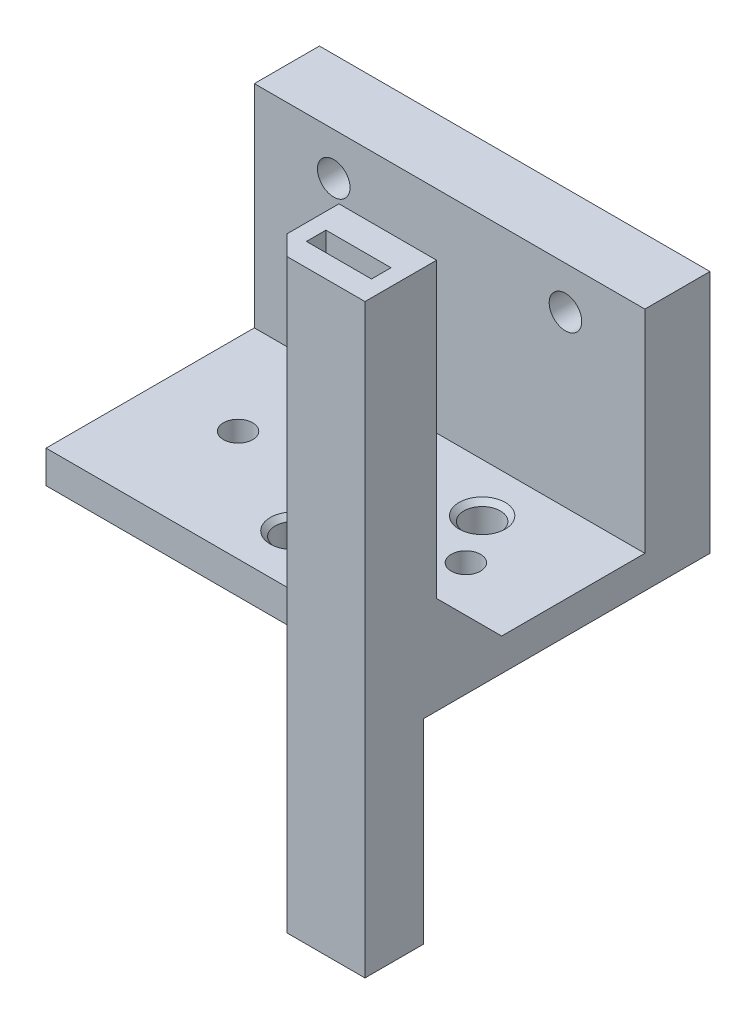
from build123d import *

# Parameters (mm, degrees)
SKETCH1_R                = 2.8
SKETCH1_R_2              = 2.25
BOSS_EXTRUDE1_DEPTH      = 5
SKETCH3_W                = 60
SKETCH3_H                = 10
BOSS_EXTRUDE3_DEPTH      = 32.5
SKETCH4_R                = 2.5
CUT_EXTRUDE1_DEPTH       = 64.798510954
CHAMFER1_SIZE            = 0.75
BOSS_EXTRUDE4_DEPTH      = 30
BOSS_EXTRUDE4_DEPTH_BACK = 60
SKETCH5_W                = 10
SKETCH5_H                = 3
CHAMFER2_SIZE            = 10
CHAMFER3_SIZE            = 5
SKETCH7_W                = 2
SKETCH7_H                = 30
CUT_EXTRUDE2_DEPTH       = 94.808315196
BOSS_EXTRUDE5_DEPTH      = 5
CUT_EXTRUDE3_DEPTH       = 91.691785736


with BuildPart() as part:
    # Sketch1 → Boss-Extrude1 (new body)
    with BuildSketch(Plane(origin=(0, 0, 0), x_dir=(1, 0, 0), z_dir=(0, 1, 0))):
        Polygon((-30, 0), (-30, 40), (30, 40), (30, 0), (30, -2), (-30, -2), align=None)
        with Locations((-12.5, 22.5)):
            Circle(SKETCH1_R, mode=Mode.SUBTRACT)
        with Locations((12.5, 22.5)):
            Circle(SKETCH1_R, mode=Mode.SUBTRACT)
        with Locations((-17.5, 15)):
            Circle(SKETCH1_R_2, mode=Mode.SUBTRACT)
        with Locations((17.5, 15)):
            Circle(SKETCH1_R_2, mode=Mode.SUBTRACT)
        with Locations((0, 6)):
            Circle(SKETCH1_R, mode=Mode.SUBTRACT)
    extrude(amount=BOSS_EXTRUDE1_DEPTH)

    # Sketch3 → Boss-Extrude3 (add)
    with BuildSketch(Plane(origin=(0, 5, 0), x_dir=(1, 0, 0), z_dir=(0, 1, 0))):
        with Locations((0, 35)):
            Rectangle(SKETCH3_W, SKETCH3_H)
    extrude(amount=BOSS_EXTRUDE3_DEPTH)

    # Sketch4 → Cut-Extrude1 (cut, through all)
    with BuildSketch(Plane(origin=(0, 0, -40), x_dir=(-1, 0, 0), z_dir=(0, 0, -1))):
        with Locations((-17.8, 31)):
            Circle(SKETCH4_R)
        with Locations((17.8, 31)):
            Circle(SKETCH4_R)
    extrude(amount=-CUT_EXTRUDE1_DEPTH, mode=Mode.SUBTRACT)

    # Chamfer1
    chamfer1_edges = [part.edges().sort_by_distance(p)[0] for p in [
        (-15.3, 5, -22.5),
        (9.7, 5, -22.5),
        (-2.8, 5, -6),
    ]]
    chamfer(chamfer1_edges, length=CHAMFER1_SIZE)

    # Sketch5 → Boss-Extrude4 (add, two sides: drawn at the far end of the back side and taken through both)
    with BuildSketch(Plane.XZ.offset(-BOSS_EXTRUDE4_DEPTH_BACK)):
        Polygon((18, 13), (15, 10), (15, 2), (30, 2), (30, 13), align=None)
        with Locations((22.5, 8)):
            Rectangle(SKETCH5_W, SKETCH5_H, mode=Mode.SUBTRACT)
    extrude(amount=BOSS_EXTRUDE4_DEPTH + BOSS_EXTRUDE4_DEPTH_BACK)

    # Chamfer2
    chamfer2_edges = [part.edges().sort_by_distance(p)[0] for p in [
        (22.5, 5, 2),
    ]]
    chamfer(chamfer2_edges, length=CHAMFER2_SIZE)

    # Chamfer3
    chamfer3_edges = [part.edges().sort_by_distance(p)[0] for p in [
        (15, 5, -3),
        (15, 2.5, 2),
    ]]
    chamfer(chamfer3_edges, length=CHAMFER3_SIZE)

    # Sketch7 → Cut-Extrude2 (cut, through all)
    with BuildSketch(Plane(origin=(30, 0, 0), x_dir=(0, 0, -1), z_dir=(1, 0, 0))):
        with Locations((-3, -15)):
            Rectangle(SKETCH7_W, SKETCH7_H)
    extrude(amount=-CUT_EXTRUDE2_DEPTH, mode=Mode.SUBTRACT)

    # Sketch8 → Boss-Extrude5 (add)
    with BuildSketch(Plane(origin=(30, 0, 0), x_dir=(0, 0, -1), z_dir=(1, 0, 0))):
        Polygon((30, 37.5), (-2, 37.5), (-2, 15), (8, 5), (30, 5), align=None)
    extrude(amount=-BOSS_EXTRUDE5_DEPTH)

    # Sketch9 → Cut-Extrude3 (cut, through all)
    with BuildSketch(Plane.ZY.offset(-25)):
        Polygon((-30, 37.5), (-30, 5), (-8, 5), (2, 15), (2, 37.5), align=None)
    extrude(amount=-CUT_EXTRUDE3_DEPTH, mode=Mode.SUBTRACT)


solid = part.part
